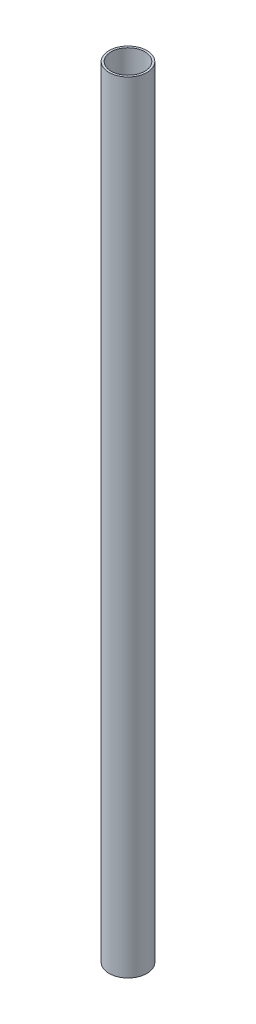
from build123d import *

# Parameters (mm, degrees)
SKETCH_1_R      = 9
SKETCH_1_R_2    = 8
EXTRUDE_2_DEPTH = 370


with BuildPart() as part:
    # 草图1 → 凸台-拉伸2 (new body)
    with BuildSketch(Plane(origin=(0, 0, 0), x_dir=(1, 0, 0), z_dir=(0, 1, 0))):
        Circle(SKETCH_1_R)
        Circle(SKETCH_1_R_2, mode=Mode.SUBTRACT)
    extrude(amount=EXTRUDE_2_DEPTH)


solid = part.part
